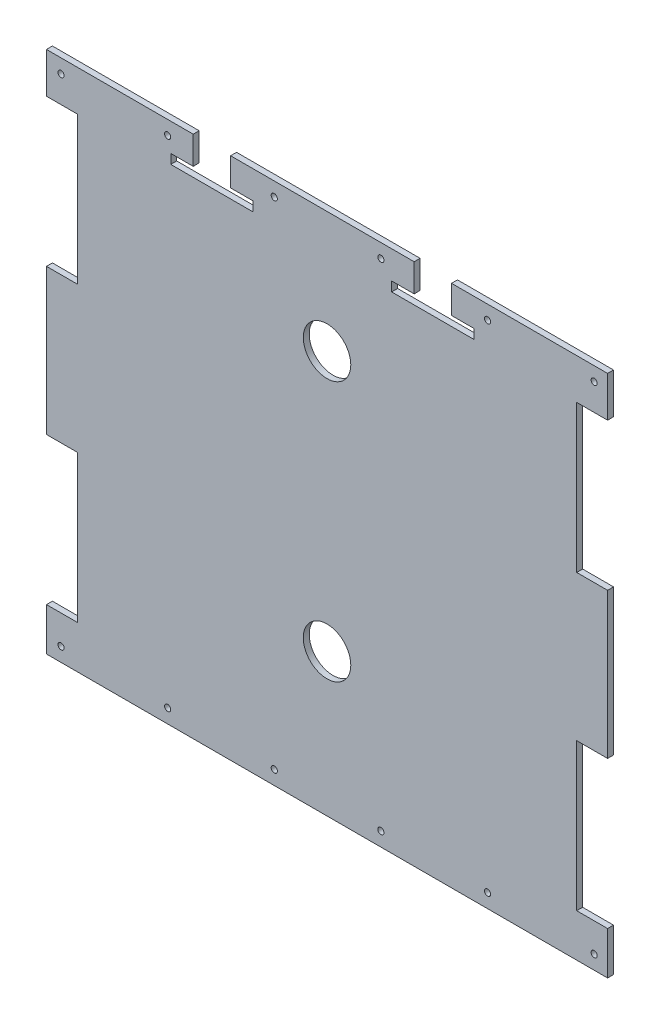
from build123d import *

# Parameters (mm, degrees)
SKETCH5_R           = 1.65
SKETCH5_R_2         = 12.7
BOSS_EXTRUDE1_DEPTH = 3.175


with BuildPart() as part:
    # Sketch5 → Boss-Extrude1 (new body)
    with BuildSketch(Plane.XY):
        Polygon((47.124604737, -7.452255775), (30.614604737, -7.452255775), (30.614604737, 71.287744225), (47.124604737, 71.287744225), (47.124604737, 149.14592508), (30.614604737, 149.14592508), (30.614604737, 227.88592508), (47.124604737, 227.88592508), (47.124604737, 249.558730102), (-36.302449898, 249.558730102), (-36.302449898, 234.650730102), (-24.302449898, 234.650730102), (-24.302449898, 229.558730102), (-36.302449898, 229.558730102), (-56.302449898, 229.558730102), (-68.302449898, 229.558730102), (-68.302449898, 234.650730102), (-56.302449898, 234.650730102), (-56.302449898, 249.558730102), (-154.402428268, 249.558730102), (-154.402428268, 234.650730102), (-142.402428268, 234.650730102), (-142.402428268, 229.558730102), (-154.402428268, 229.558730102), (-174.402428268, 229.558730102), (-186.402428268, 229.558730102), (-186.402428268, 234.650730102), (-174.402428268, 234.650730102), (-174.402428268, 249.558730102), (-252.849395263, 249.558730102), (-252.849395263, 227.88592508), (-236.339395263, 227.88592508), (-236.339395263, 149.14592508), (-252.849395263, 149.14592508), (-252.849395263, 71.287744225), (-236.339395263, 71.287744225), (-236.339395263, -7.452255775), (-252.849395263, -7.452255775), (-252.849395263, -30.349269898), (47.124604737, -30.349269898), align=None)
        with Locations((39.94351791, -22.890690042)):
            Circle(SKETCH5_R, mode=Mode.SUBTRACT)
        with Locations((-17.05648209, -22.890690042)):
            Circle(SKETCH5_R, mode=Mode.SUBTRACT)
        with Locations((-74.05648209, -22.890690042)):
            Circle(SKETCH5_R, mode=Mode.SUBTRACT)
        with Locations((-131.05648209, -22.890690042)):
            Circle(SKETCH5_R, mode=Mode.SUBTRACT)
        with Locations((-188.05648209, -22.890690042)):
            Circle(SKETCH5_R, mode=Mode.SUBTRACT)
        with Locations((-245.05648209, -22.890690042)):
            Circle(SKETCH5_R, mode=Mode.SUBTRACT)
        with Locations((39.94351791, 242.101620414)):
            Circle(SKETCH5_R, mode=Mode.SUBTRACT)
        with Locations((-17.05648209, 242.101620414)):
            Circle(SKETCH5_R, mode=Mode.SUBTRACT)
        with Locations((-74.05648209, 242.101620414)):
            Circle(SKETCH5_R, mode=Mode.SUBTRACT)
        with Locations((-131.05648209, 242.101620414)):
            Circle(SKETCH5_R, mode=Mode.SUBTRACT)
        with Locations((-188.05648209, 242.101620414)):
            Circle(SKETCH5_R, mode=Mode.SUBTRACT)
        with Locations((-245.05648209, 242.101620414)):
            Circle(SKETCH5_R, mode=Mode.SUBTRACT)
        with Locations((-102.862395263, 184.854342805)):
            Circle(SKETCH5_R_2, mode=Mode.SUBTRACT)
        with Locations((-102.862395263, 45.850730102)):
            Circle(SKETCH5_R_2, mode=Mode.SUBTRACT)
    extrude(amount=BOSS_EXTRUDE1_DEPTH)


solid = part.part
